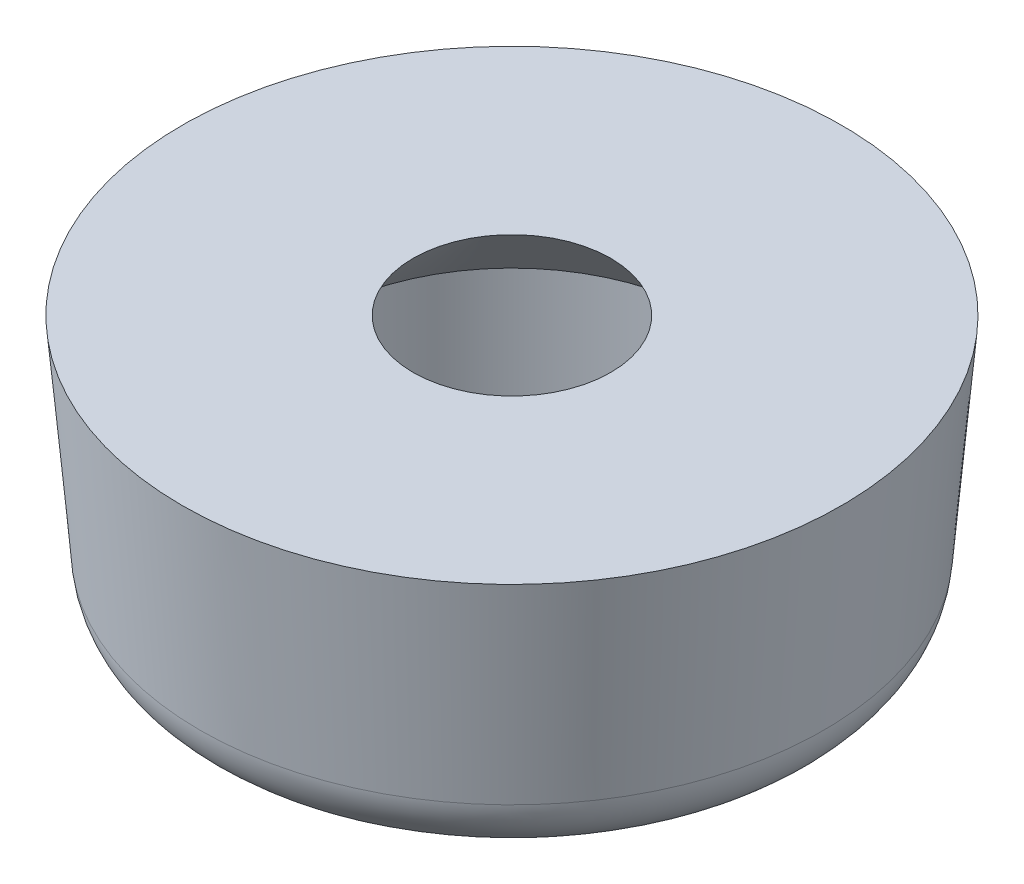
from build123d import *

# Parameters (mm, degrees)
SKETCH_1_R          = 5
EXTRUDE_1_DEPTH     = 4
SKETCH_2_R          = 1.5
CUT_EXTRUDE_1_DEPTH = 5
DRAFT_1_ANGLE       = -1
DRAFT_4_ANGLE       = -5
SKETCH_3_R          = 3
CUT_EXTRUDE_2_DEPTH = 2
FILLET_1_R          = 1
CHAMFER_1_SIZE      = 2


with BuildPart() as part:
    # Эскиз1 → Бобышка-Вытянуть1 (new body)
    with BuildSketch(Plane(origin=(0, 0, 0), x_dir=(1, 0, 0), z_dir=(0, 1, 0))):
        with Locations(Location((0, 0, 0), (0, 0, 270))):
            Circle(SKETCH_1_R)
    extrude(amount=EXTRUDE_1_DEPTH)

    # Эскиз2 → Вырез-Вытянуть1 (cut)
    with BuildSketch(Plane(origin=(0, 4, 0), x_dir=(1, 0, 0), z_dir=(0, 1, 0))):
        with Locations(Location((0, 0, 0), (0, 0, 270))):
            Circle(SKETCH_2_R)
    extrude(amount=-CUT_EXTRUDE_1_DEPTH, mode=Mode.SUBTRACT)

    # Уклон1
    draft_1_faces = [part.faces().sort_by_distance(p)[0] for p in [
        (0, 2, -5),
    ]]
    draft(draft_1_faces, Plane.ZX.offset(4), DRAFT_1_ANGLE)

    # Уклон4
    draft_4_faces = [part.faces().sort_by_distance(p)[0] for p in [
        (0, 2, -4.96508987),
    ]]
    draft(draft_4_faces, Plane.ZX.offset(4), DRAFT_4_ANGLE)

    # Эскиз3 → Вырез-Вытянуть2 (cut)
    with BuildSketch(Plane.XZ):
        with Locations(Location((0, 0, 0), (0, 0, 270))):
            Circle(SKETCH_3_R)
    extrude(amount=-CUT_EXTRUDE_2_DEPTH, mode=Mode.SUBTRACT)

    # Скругление1
    fillet_1_edges = [part.edges().sort_by_distance(p)[0] for p in [
        (0, 0, -4.650045346),
    ]]
    fillet(fillet_1_edges, radius=FILLET_1_R)

    # Фаска1
    # the kernel refuses this chamfer: 2 mm, written as the material it takes off along each edge
    with BuildSketch(Plane(origin=(0, 2, 0), x_dir=(0, 0, 1), z_dir=(-1, 0, 0))) as chamfer_1_piece_1_section:
        Polygon((1.5, CHAMFER_1_SIZE), (1.5 + CHAMFER_1_SIZE, 0), (1.5, 0), align=None)
    chamfer_1_piece_1 = revolve(axis=Axis((0, 2, 0), (0, 1, 0)), mode=Mode.PRIVATE)
    chamfer_1_piece_1 = chamfer_1_piece_1 & Plane(origin=(0, 3.257194568, 0), x_dir=(0, 0, -1), z_dir=(0, -1, 0)) * Cylinder(3, 14, mode=Mode.PRIVATE)
    add(chamfer_1_piece_1, mode=Mode.SUBTRACT)


solid = part.part
